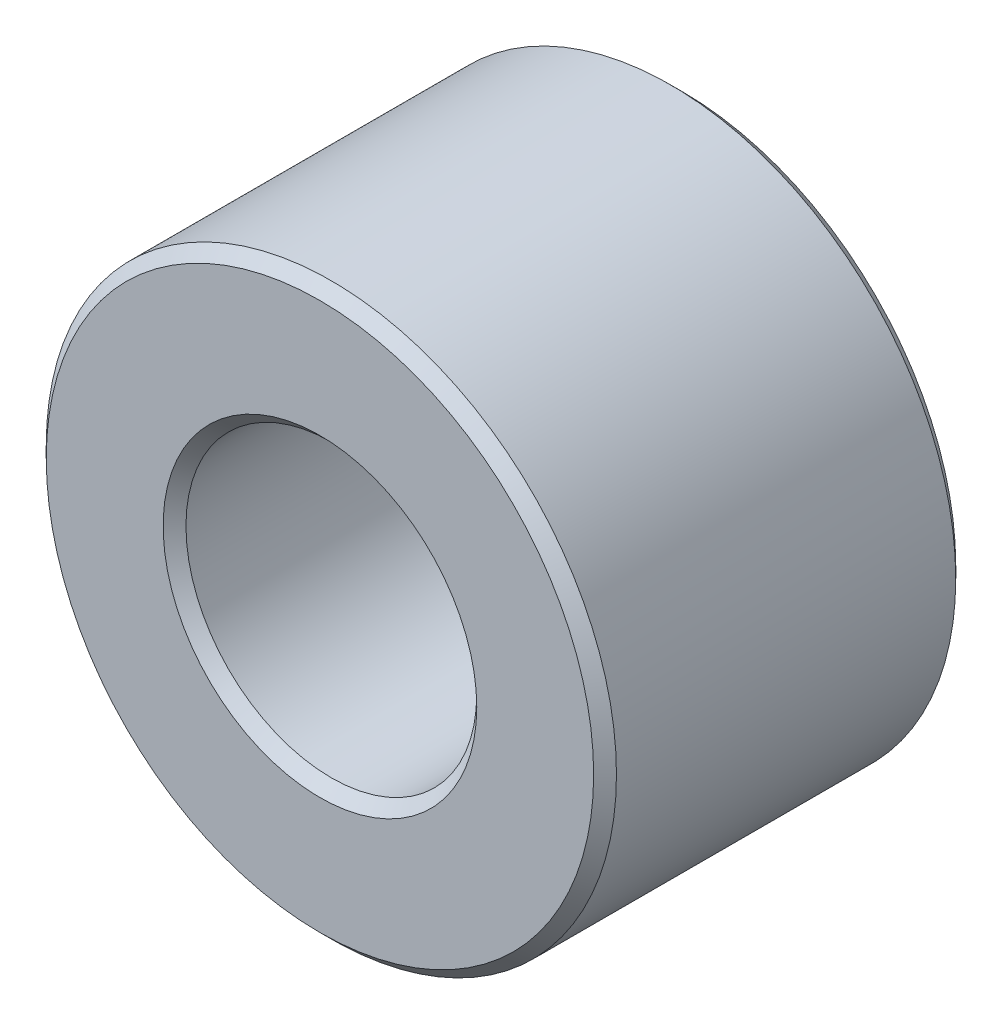
from build123d import *

# Parameters (mm, degrees)
SKETCH1_R           = 5
SKETCH1_R_2         = 2.55
BOSS_EXTRUDE1_DEPTH = 6.35
CHAMFER1_SIZE       = 0.2


with BuildPart() as part:
    # Sketch1 → Boss-Extrude1 (new body)
    with BuildSketch(Plane.XY):
        Circle(SKETCH1_R)
        Circle(SKETCH1_R_2, mode=Mode.SUBTRACT)
    extrude(amount=BOSS_EXTRUDE1_DEPTH)

    # Chamfer1
    chamfer1_edges = [part.edges().sort_by_distance(p)[0] for p in [
        (-5, 0, 0),
        (-2.55, 0, 0),
        (-2.55, 0, 6.35),
        (-5, 0, 6.35),
    ]]
    chamfer(chamfer1_edges, length=CHAMFER1_SIZE)


solid = part.part
